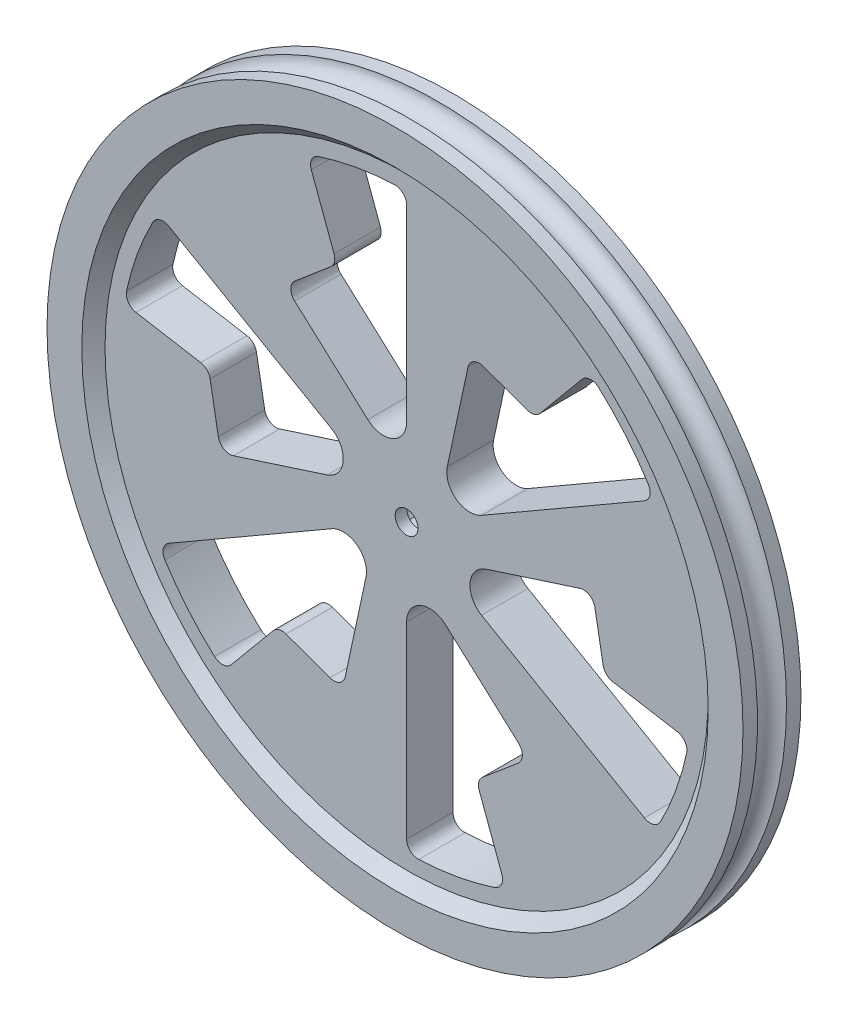
from build123d import *

# Parameters (mm, degrees)
SKETCH1_R           = 38.1
BOSS_EXTRUDE1_DEPTH = 6.35
FILLET1_R           = 2.54
CUT_EXTRUDE1_START  = -2.54
CUT_EXTRUDE1_DEPTH  = 6.35
SKETCH3_W           = 34.29
SKETCH3_H           = 1.27
SKETCH3_R           = 1.5875
FILLET2_R           = 1.27
SKETCH4_R           = 1.25
CUT_EXTRUDE2_DEPTH  = 6.35
CHAMFER1_SIZE       = 1.27


with BuildPart() as part:
    # Sketch1 → Boss-Extrude1 (new body)
    with BuildSketch(Plane.XY):
        Circle(SKETCH1_R)
        with BuildLine():
            Line((0, 3.753578648), (0, 31.356419273))
            ThreePointArc((0, 31.356419273), (-5.528532606, 30.86519653), (-10.883847669, 29.406919076))
            Line((-10.883847669, 29.406919076), (-7.631535777, 20.619542081))
            Line((-7.631535777, 20.619542081), (-13.336198426, 15.806394174))
            Line((-13.336198426, 15.806394174), (0, 3.753578648))
        make_face(mode=Mode.SUBTRACT)
        with BuildLine():
            Line((20.025215132, 24.12914811), (14.041279368, 16.918874893))
            Line((14.041279368, 16.918874893), (7.020639684, 19.452683713))
            Line((7.020639684, 19.452683713), (3.250694465, 1.876789324))
            Line((3.250694465, 1.876789324), (27.155455662, 15.678209636))
            ThreePointArc((27.155455662, 15.678209636), (23.965777985, 20.220447947), (20.025215132, 24.12914811))
        make_face(mode=Mode.SUBTRACT)
        with BuildLine():
            Line((20.35683811, 3.646289539), (3.250694465, -1.876789324))
            Line((3.250694465, -1.876789324), (27.155455662, -15.678209636))
            ThreePointArc((27.155455662, -15.678209636), (29.494310591, -10.644748583), (30.909062801, -5.277770966))
            Line((30.909062801, -5.277770966), (21.672815145, -3.700667188))
            Line((21.672815145, -3.700667188), (20.35683811, 3.646289539))
        make_face(mode=Mode.SUBTRACT)
        with BuildLine():
            Line((13.336198426, -15.806394174), (0, -3.753578648))
            Line((0, -3.753578648), (0, -31.356419273))
            ThreePointArc((0, -31.356419273), (5.528532606, -30.86519653), (10.883847669, -29.406919076))
            Line((10.883847669, -29.406919076), (7.631535777, -20.619542081))
            Line((7.631535777, -20.619542081), (13.336198426, -15.806394174))
        make_face(mode=Mode.SUBTRACT)
        with BuildLine():
            Line((-7.020639684, -19.452683713), (-3.250694465, -1.876789324))
            Line((-3.250694465, -1.876789324), (-27.155455662, -15.678209636))
            ThreePointArc((-27.155455662, -15.678209636), (-23.965777985, -20.220447947), (-20.025215132, -24.12914811))
            Line((-20.025215132, -24.12914811), (-14.041279368, -16.918874893))
            Line((-14.041279368, -16.918874893), (-7.020639684, -19.452683713))
        make_face(mode=Mode.SUBTRACT)
        with BuildLine():
            Line((-20.35683811, -3.646289539), (-3.250694465, 1.876789324))
            Line((-3.250694465, 1.876789324), (-27.155455662, 15.678209636))
            ThreePointArc((-27.155455662, 15.678209636), (-29.494310591, 10.644748583), (-30.909062801, 5.277770966))
            Line((-30.909062801, 5.277770966), (-21.672815145, 3.700667188))
            Line((-21.672815145, 3.700667188), (-20.35683811, -3.646289539))
        make_face(mode=Mode.SUBTRACT)
    extrude(amount=BOSS_EXTRUDE1_DEPTH)

    # Fillet1
    fillet1_edges = [part.edges().sort_by_distance(p)[0] for p in [
        (0, 3.753578648, 3.175),
        (3.250694465, 1.876789324, 3.175),
        (3.250694465, -1.876789324, 3.175),
        (0, -3.753578648, 3.175),
        (-3.250694465, -1.876789324, 3.175),
        (-3.250694465, 1.876789324, 3.175),
    ]]
    fillet(fillet1_edges, radius=FILLET1_R)

    # Sketch2 → Cut-Extrude1 (cut)
    with BuildSketch(Plane.XY.offset(6.35).offset(CUT_EXTRUDE1_START)):
        with BuildLine():
            Line((-1.956171069, 1.905), (1.956171069, 1.905))
            ThreePointArc((1.956171069, 1.905), (2.7305, 0), (1.956171069, -1.905))
            Line((1.956171069, -1.905), (-1.956171069, -1.905))
            ThreePointArc((-1.956171069, -1.905), (-2.7305, 0), (-1.956171069, 1.905))
        make_face()
    extrude(amount=-CUT_EXTRUDE1_DEPTH, mode=Mode.SUBTRACT)

    # Sketch3 → Cut-Revolve1 (revolve, cut)
    with BuildSketch(Plane(origin=(0, 0, 0), x_dir=(1, 0, 0), z_dir=(0, 1, 0))):
        with Locations((-17.145, -5.715)):
            Rectangle(SKETCH3_W, SKETCH3_H)
        with Locations((-38.1, -3.175)):
            Circle(SKETCH3_R)
    revolve(axis=Axis((0, 0, 1.27), (0, 0, 1)), mode=Mode.SUBTRACT)

    # Fillet2
    fillet2_edges = [part.edges().sort_by_distance(p)[0] for p in [
        (-27.155455662, -15.678209636, 2.54),
        (-7.020639684, -19.452683713, 2.54),
        (-14.041279368, -16.918874893, 2.54),
        (-20.025215132, -24.12914811, 2.54),
        (13.336198426, -15.806394174, 2.54),
        (7.631535777, -20.619542081, 2.54),
        (10.883847669, -29.406919076, 2.54),
        (0, -31.356419273, 2.54),
        (20.35683811, 3.646289539, 2.54),
        (21.672815145, -3.700667188, 2.54),
        (30.909062801, -5.277770966, 2.54),
        (27.155455662, -15.678209636, 2.54),
        (27.155455662, 15.678209636, 2.54),
        (7.020639684, 19.452683713, 2.54),
        (14.041279368, 16.918874893, 2.54),
        (20.025215132, 24.12914811, 2.54),
        (0, 31.356419273, 2.54),
        (-13.336198426, 15.806394174, 2.54),
        (-7.631535777, 20.619542081, 2.54),
        (-10.883847669, 29.406919076, 2.54),
        (-20.35683811, -3.646289539, 2.54),
        (-21.672815145, 3.700667188, 2.54),
        (-30.909062801, 5.277770966, 2.54),
        (-27.155455662, 15.678209636, 2.54),
    ]]
    fillet(fillet2_edges, radius=FILLET2_R)

    # Sketch4 → Cut-Extrude2 (cut)
    with BuildSketch(Plane.XY.offset(5.08)):
        Circle(SKETCH4_R)
    extrude(amount=-CUT_EXTRUDE2_DEPTH, mode=Mode.SUBTRACT)

    # Chamfer1
    chamfer1_edges = [part.edges().sort_by_distance(p)[0] for p in [
        (34.29, 0, 5.08),
    ]]
    chamfer(chamfer1_edges, length=CHAMFER1_SIZE - 0.0001)  # a hair under: the kernel refuses the full size


solid = part.part
